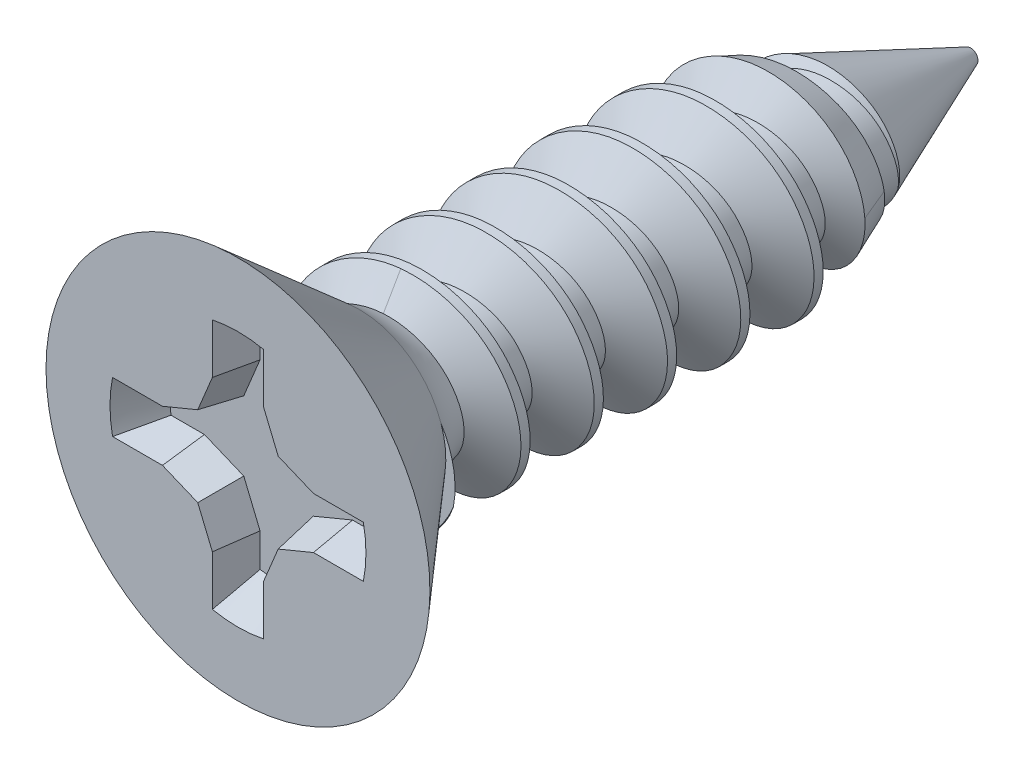
from build123d import *
from build123d.topology import SkipClean

# Parameters (mm, degrees)
SKETCH1_R           = 3.3274
EXTRUDE3_DEPTH      = 2.1082
SKETCH16_W          = 10.5918
SKETCH16_H          = 1.065192336
SWEEP1_PITCH        = 1.27
LPATTERN3_COUNT     = 8
LPATTERN3_PITCH     = 1.27
LPATTERN3_COL_COUNT = 2
LPATTERN3_COL_PITCH = 1.27
CUT_EXTRUDE3_DEPTH  = 0.702733333
CIRPATTERN1_COUNT   = 4
DRAFT2_ANGLE        = 10


# Read off the part's stored shape, not the designer's step: Draft1
with BuildPart() as part:
    # Sketch1 → Extrude3 (new body)
    with BuildSketch(Plane.XY):
        Circle(SKETCH1_R)
    extrude(amount=EXTRUDE3_DEPTH)

    # Sketch11 → Cut-Revolve3 (revolve, cut)
    with BuildSketch(Plane(origin=(0, 0, 0), x_dir=(0, 0, -1), z_dir=(1, 0, 0)), mode=Mode.PRIVATE) as cut_revolve3_sk:
        Polygon((-2.1082, 3.3274), (0, 1.494769699), (0, 3.3274), align=None)
    revolve(cut_revolve3_sk.sketch.rotate(Axis((0, 0, 0), (0, 0, 1)), 90), axis=Axis((0, 0, 0), (0, 0, 1)), mode=Mode.SUBTRACT)

    # Sketch16 → Revolve1 (revolve)
    with BuildSketch(Plane(origin=(0, 0, 0), x_dir=(0, 0, -1), z_dir=(1, 0, 0)), mode=Mode.PRIVATE) as revolve1_sk:
        with Locations((5.2959, 0.532596168)):
            Rectangle(SKETCH16_W, SKETCH16_H)
    revolve(revolve1_sk.sketch.rotate(Axis((0, 0, 0), (0, 0, 1)), 90), axis=Axis((0, 0, 0), (0, 0, 1)))

    # Sweep1: the profile of Sketch14 profile screwed along a right-hand helix of 1.5 turns, 6 arcs to a turn; built about Z, then put on its axis
    sweep1_z = Axis((0, 0, 0), (0, 0, 1))
    sweep1_corners = [(1.7526, 0, -0.079375), (1.7526, 0, 0.079375), (1.064892336, 0, 0.476423205), (1.064892336, 0, -0.476423205)]
    with BuildLine(mode=Mode.PRIVATE) as sweep1_profile:
        Line(sweep1_corners[0], sweep1_corners[1])
        Line(sweep1_corners[1], sweep1_corners[2])
        Line(sweep1_corners[2], sweep1_corners[3])
        Line(sweep1_corners[3], sweep1_corners[0])
    sweep1_cap = Face(sweep1_profile.wire())
    sweep1_turn_angles = [0, 30, 60, 90, 120, 150, 180, 210, 240, 270, 300, 330, 360]
    sweep1_turn_weights = [1, 0.8660254037844387, 1, 0.8660254037844387, 1, 0.8660254037844387, 1, 0.8660254037844387, 1, 0.8660254037844387, 1, 0.8660254037844387, 1]
    sweep1_turn_rails = [Edge.make_bspline([Vector(p[0], p[1], 0).rotate(sweep1_z, sweep1_turn_angles[k]) / sweep1_turn_weights[k] + Vector(0, 0, p[2] + SWEEP1_PITCH * sweep1_turn_angles[k] / 360) for k in range(13)], [0, 0, 0, 1, 1, 2, 2, 3, 3, 4, 4, 5, 5, 6, 6, 6], 2, sweep1_turn_weights) for p in sweep1_corners]
    sweep1_turn_sides = [Face.make_surface_from_curves(sweep1_turn_rails[p[0]], sweep1_turn_rails[p[1]]) for p in [(0, 1), (1, 2), (2, 3), (3, 0)]]
    sweep1_last_angles = [360, 390, 420, 450, 480, 510, 540]
    sweep1_last_weights = [1, 0.8660254037844387, 1, 0.8660254037844387, 1, 0.8660254037844327, 1]
    sweep1_last_rails = [Edge.make_bspline([Vector(p[0], p[1], 0).rotate(sweep1_z, sweep1_last_angles[k]) / sweep1_last_weights[k] + Vector(0, 0, p[2] + SWEEP1_PITCH * sweep1_last_angles[k] / 360) for k in range(7)], [0, 0, 0, 1, 1, 2, 2, 3, 3, 3], 2, sweep1_last_weights) for p in sweep1_corners]
    sweep1_last_sides = [Face.make_surface_from_curves(sweep1_last_rails[p[0]], sweep1_last_rails[p[1]]) for p in [(0, 1), (1, 2), (2, 3), (3, 0)]]
    sweep1 = Plane(origin=(0, 0, -0.79375), x_dir=(0, 1, 0), z_dir=(0, 0, -1)) * Solid(Shell([*sweep1_turn_sides, *sweep1_last_sides, sweep1_cap, sweep1_cap.rotate(sweep1_z, 540).moved(Location((0, 0, SWEEP1_PITCH * 540 / 360)))]))
    add(sweep1)

    # LPattern3: Sweep1 ×8
    with Locations(*[(0, 0, -i * LPATTERN3_PITCH) for i in range(1, LPATTERN3_COUNT)]):
        add(sweep1)

    # LPattern3 col: Sweep1 ×2
    with Locations(*[(0, 0, i * LPATTERN3_COL_PITCH) for i in range(1, LPATTERN3_COL_COUNT)]):
        add(sweep1)

    # Sketch13 → Cut-Revolve4 (revolve, cut)
    with BuildSketch(Plane(origin=(0, 0, 0), x_dir=(0, 0, -1), z_dir=(1, 0, 0)), mode=Mode.PRIVATE) as cut_revolve4_sk:
        Polygon((10.5918, 0.127), (6.667254433, 1.7526), (10.5918, 1.7526), (13.1318, 1.7526), (13.1318, 0.127), align=None)
    revolve(cut_revolve4_sk.sketch.rotate(Axis((0, 0, 0), (0, 0, -1)), 90), axis=Axis((0, 0, 0), (0, 0, -1)), mode=Mode.SUBTRACT)

    # Sketch12 → Cut-Extrude3 (cut)
    with BuildSketch(Plane.XY.offset(2.1082)):
        with BuildLine():
            Line((2.173448579, 0.443653333), (1.308550956, 0.443653333))
            Line((1.308550956, 0.443653333), (0.696975982, 0.696975982))
            Line((0.696975982, 0.696975982), (0.443653333, 1.308550956))
            Line((0.443653333, 1.308550956), (0.443653333, 2.173448579))
            ThreePointArc((0.443653333, 2.173448579), (0.22295568, 2.207033704), (0, 2.218266667))
            Line((0, 2.218266667), (0, 0))
            Line((0, 0), (2.218266667, 0))
            ThreePointArc((2.218266667, 0), (2.207033704, 0.22295568), (2.173448579, 0.443653333))
        make_face()
    cut_extrude3 = extrude(amount=-CUT_EXTRUDE3_DEPTH, mode=Mode.SUBTRACT)

    # CirPattern1: Cut-Extrude3 ×4 about axis
    cirpattern1_axis = Axis((0, 0, 0), (0, 0, 1))
    for i in range(1, CIRPATTERN1_COUNT):
        add(cut_extrude3.rotate(cirpattern1_axis, i * 360 / CIRPATTERN1_COUNT), mode=Mode.SUBTRACT)

    # Draft1 outline → Draft1 (revolve)
    with BuildSketch(Plane.XZ):
        Polygon((2.218266667, 2.1082), (1.890576732, 1.405466667), (2.218266667, 1.405466667), align=None)
    revolve(axis=Axis((0, 0, 0), (0, 0, 1)))

    # Draft2
    draft2_faces = [part.faces().sort_by_distance(p)[0] for p in [
        (0.443653333, 1.663925596, 1.785022011),
        (0.570314658, 1.002763469, 1.756833333),
        (1.002763469, 0.570314658, 1.756833333),
        (1.663925596, 0.443653333, 1.785022011),
        (1.663925596, -0.443653333, 1.785022011),
        (1.002763469, -0.570314658, 1.756833333),
        (0.570314658, -1.002763469, 1.756833333),
        (0.443653333, -1.663925596, 1.785022011),
        (-0.443653333, -1.663925596, 1.785022011),
        (-0.570314658, -1.002763469, 1.756833333),
        (-1.002763469, -0.570314658, 1.756833333),
        (-1.663925596, -0.443653333, 1.785022011),
        (-1.663925596, 0.443653333, 1.785022011),
        (-1.002763469, 0.570314658, 1.756833333),
        (-0.570314658, 1.002763469, 1.756833333),
        (-0.443653333, 1.663925596, 1.785022011),
    ]]
    draft(draft2_faces, Plane.XY.offset(2.1082), DRAFT2_ANGLE)

    # Sketch17 → Cut-Revolve5 (revolve, cut)
    with SkipClean():  # the faces are left unmerged after this step: merging them gives an invalid solid
        with BuildSketch(Plane(origin=(0, 0, 0), x_dir=(0, 0, -1), z_dir=(1, 0, 0)), mode=Mode.PRIVATE) as cut_revolve5_sk:
            Polygon((-2.1082, 3.3274), (0, 3.3274), (0, 1.494769699), align=None)
        revolve(cut_revolve5_sk.sketch.rotate(Axis((0, 0, 0), (0, 0, 1)), 289.163683859), axis=Axis((0, 0, 0), (0, 0, 1)), mode=Mode.SUBTRACT)

    # Sketch18 → Revolve2 (revolve)
    with SkipClean():  # the faces are left unmerged after this step: merging them gives an invalid solid
        with BuildSketch(Plane(origin=(0, 0, 0), x_dir=(0, 0, -1), z_dir=(1, 0, 0)), mode=Mode.PRIVATE) as revolve2_sk:
            with BuildLine():
                Line((0, 1.494769699), (0, 0))
                Line((0, 0), (1.14895685, 0))
                Line((1.14895685, 0), (1.14895685, 1.065192336))
                ThreePointArc((1.14895685, 1.065192336), (0.535638304, 1.176098396), (0, 1.494769699))
            make_face()
        revolve(revolve2_sk.sketch.rotate(Axis((0, 0, 0), (0, 0, 1)), 289.163683859), axis=Axis((0, 0, 0), (0, 0, 1)))


solid = part.part
